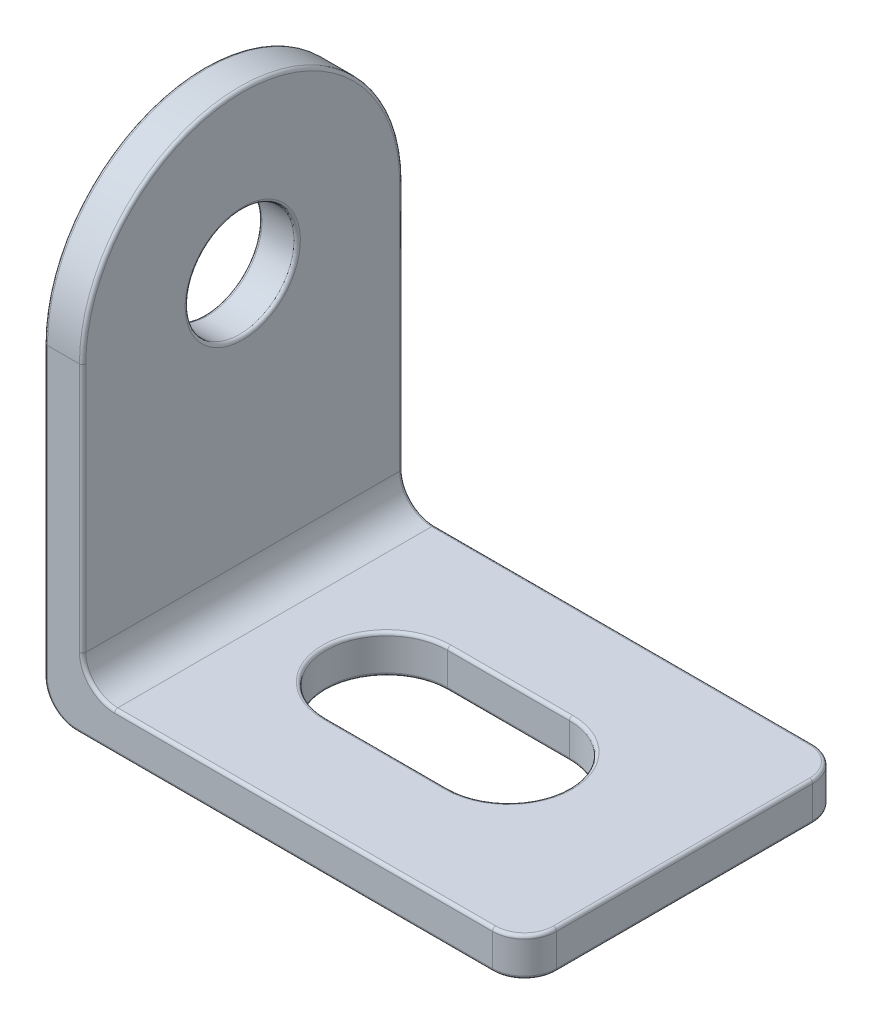
from build123d import *

# Parameters (mm, degrees)
BOSS_EXTRUDE1_DEPTH = 10
FILLET1_R           = 1
SKETCH2_R           = 1.7
CUT_EXTRUDE1_DEPTH  = 23.703303724
CUT_EXTRUDE2_DEPTH  = 23.703303724
CUT_EXTRUDE3_DEPTH  = 23.703303724
FILLET2_R           = 0.1
FILLET3_R           = 1


with BuildPart() as part:
    # Sketch1 → Boss-Extrude1 (new body)
    with BuildSketch(Plane.XY):
        Polygon((0, 0), (0, 15), (1.2, 15), (1.2, 1.2), (15, 1.2), (15, 0), align=None)
    extrude(amount=BOSS_EXTRUDE1_DEPTH)

    # Fillet1
    fillet1_edges = [part.edges().sort_by_distance(p)[0] for p in [
        (0, 0, 5),
        (1.2, 1.2, 5),
    ]]
    fillet(fillet1_edges, radius=FILLET1_R)

    # Sketch2 → Cut-Extrude1 (cut, through all)
    with BuildSketch(Plane(origin=(1.2, 0, 0), x_dir=(0, 0, -1), z_dir=(1, 0, 0))):
        with Locations(Location((-5, 10, 0), (0, 0, 90))):
            Circle(SKETCH2_R)
    extrude(amount=-CUT_EXTRUDE1_DEPTH, mode=Mode.SUBTRACT)

    # Sketch3 → Cut-Extrude2 (cut, through all)
    with BuildSketch(Plane(origin=(1.2, 0, 0), x_dir=(0, 0, -1), z_dir=(1, 0, 0))):
        with BuildLine():
            Line((0, 10), (1, 10))
            Line((1, 10), (1, 16))
            Line((1, 16), (-11, 16))
            Line((-11, 16), (-11, 10))
            Line((-11, 10), (-10, 10))
            ThreePointArc((-10, 10), (-5, 15), (0, 10))
        make_face()
    extrude(amount=-CUT_EXTRUDE2_DEPTH, mode=Mode.SUBTRACT)

    # Sketch4 → Cut-Extrude3 (cut, through all)
    with BuildSketch(Plane(origin=(0, 1.2, 0), x_dir=(1, 0, 0), z_dir=(0, 1, 0))):
        with BuildLine():
            Line((5.7, -3.1), (9.5, -3.1))
            ThreePointArc((9.5, -3.1), (11.4, -5), (9.5, -6.9))
            Line((9.5, -6.9), (5.7, -6.9))
            ThreePointArc((5.7, -6.9), (3.8, -5), (5.7, -3.1))
        make_face()
    extrude(amount=-CUT_EXTRUDE3_DEPTH, mode=Mode.SUBTRACT)

    # Fillet2
    fillet2_edges = [part.edges().sort_by_distance(p)[0] for p in [
        (15, 1.2, 5),
        (15, 0, 5),
        (8.6, 1.2, 10),
        (8, 0, 0),
        (8, 0, 10),
        (1.2, 6.1, 0),
        (0.292893219, 0.292893219, 0),
        (1.2, 6.1, 10),
        (0.292893219, 0.292893219, 10),
        (1.492893219, 1.492893219, 0),
        (1.492893219, 1.492893219, 10),
        (0, 8.3, 5),
        (1.2, 8.3, 5),
        (0, 5.5, 0),
        (0, 5.5, 10),
        (0, 15, 5),
        (1.2, 15, 5),
        (3.8, 0, 5),
        (7.6, 0, 3.1),
        (11.4, 0, 5),
        (7.6, 0, 6.9),
        (3.8, 1.2, 5),
        (7.6, 1.2, 6.9),
        (11.4, 1.2, 5),
        (7.6, 1.2, 3.1),
        (8.6, 1.2, 0),
    ]]
    fillet(fillet2_edges, radius=FILLET2_R)

    # Fillet3
    # the kernel refuses this fillet: 1 mm, written as the material it takes off along each edge
    with BuildSketch(Plane(origin=(14, 0, 9), x_dir=(1, 0, 0), z_dir=(0, 0, -1))) as fillet3_piece_1:
        with BuildLine():
            CenterArc((0.9, -0.1), 0.1, 0, 90)
            Line((1, -0.1), (1, 0))
            Line((1, 0), (0.9, 0))
        make_face()
    revolve(axis=Axis((14, 0, 9), (0, -1, 0)), revolution_arc=90, mode=Mode.SUBTRACT)
    with BuildSketch(Plane(origin=(14, 0, 1), x_dir=(0, 0, -1), z_dir=(-1, 0, 0))) as fillet3_piece_2:
        with BuildLine():
            CenterArc((0.9, -0.1), 0.1, 0, 90)
            Line((1, -0.1), (1, 0))
            Line((1, 0), (0.9, 0))
        make_face()
    revolve(axis=Axis((14, 0, 1), (0, -1, 0)), revolution_arc=90, mode=Mode.SUBTRACT)
    with BuildSketch(Plane(origin=(14, 1.2, 9), x_dir=(0, 0, 1), z_dir=(-1, 0, 0))) as fillet3_piece_3:
        with BuildLine():
            CenterArc((0.9, -0.1), 0.1, 0, 90)
            Line((1, -0.1), (1, 0))
            Line((1, 0), (0.9, 0))
        make_face()
    revolve(axis=Axis((14, 1.2, 9), (0, 1, 0)), revolution_arc=90, mode=Mode.SUBTRACT)
    with BuildSketch(Plane(origin=(14, 1.2, 1), x_dir=(1, 0, 0), z_dir=(0, 0, 1))) as fillet3_piece_4:
        with BuildLine():
            CenterArc((0.9, -0.1), 0.1, 0, 90)
            Line((1, -0.1), (1, 0))
            Line((1, 0), (0.9, 0))
        make_face()
    revolve(axis=Axis((14, 1.2, 1), (0, 1, 0)), revolution_arc=90, mode=Mode.SUBTRACT)
    with BuildSketch(Plane(origin=(15, 1.2, 0), x_dir=(-1, 0, 0), z_dir=(0, -1, 0))) as fillet3_piece_5:
        with BuildLine():
            CenterArc((FILLET3_R, -FILLET3_R), FILLET3_R, 90, 90)
            Line((0, -FILLET3_R), (0, 0))
            Line((0, 0), (FILLET3_R, 0))
        make_face()
    extrude(amount=1.2, mode=Mode.SUBTRACT)
    with BuildSketch(Plane(origin=(15, 1.2, 10), x_dir=(-1, 0, 0), z_dir=(0, -1, 0))) as fillet3_piece_6:
        with BuildLine():
            CenterArc((FILLET3_R, FILLET3_R), FILLET3_R, 180, 90)
            Line((0, FILLET3_R), (0, 0))
            Line((0, 0), (FILLET3_R, 0))
        make_face()
    extrude(amount=1.2, mode=Mode.SUBTRACT)


solid = part.part
